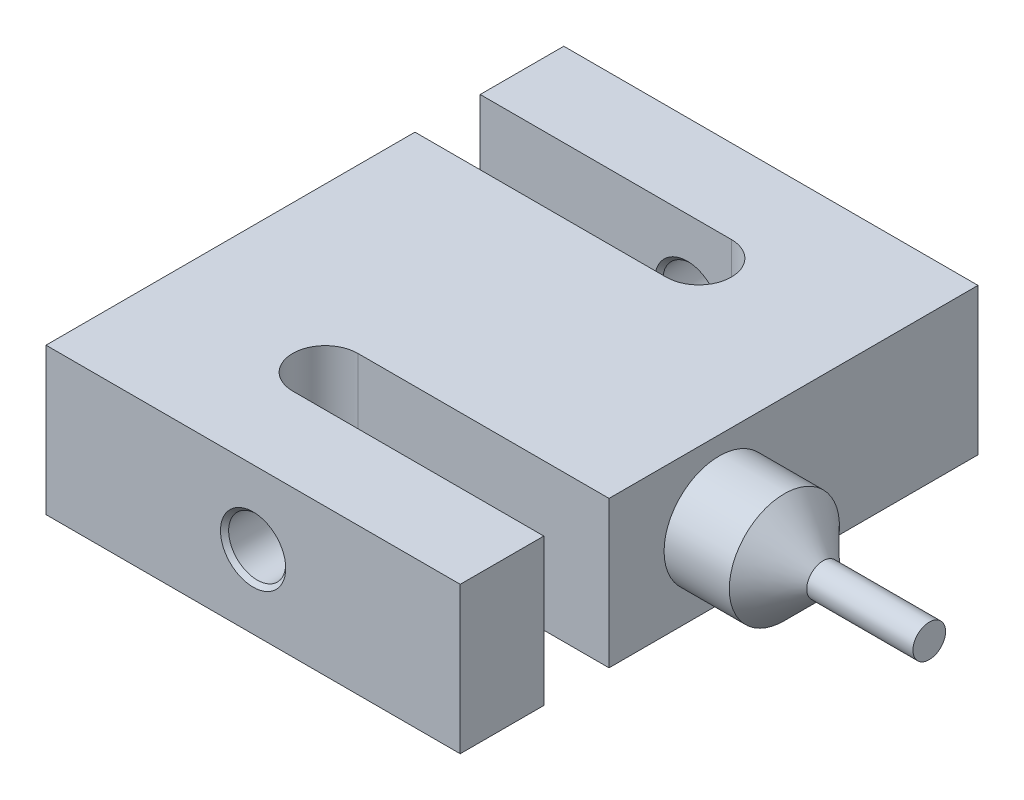
from build123d import *

# Parameters (mm, degrees)
BOSS_EXTRUDE1_DEPTH = 9
CIRPATTERN1_COUNT   = 2


# Read off the part's stored shape, not the designer's step: M8x1.0 Tapped Hole1
with BuildPart() as part:
    # Sketch1 → Boss-Extrude1 (new, symmetric)
    with BuildSketch(Plane(origin=(0, 0, 0), x_dir=(1, 0, 0), z_dir=(0, 1, 0))):
        with BuildLine():
            Line((-25.4, 0), (25.4, 0))
            Line((25.4, 0), (25.4, 31.75))
            Line((25.4, 31.75), (-25.4, 31.75))
            Line((-25.4, 31.75), (-25.4, 21.5))
            Line((-25.4, 21.5), (5.4, 21.5))
            ThreePointArc((5.4, 21.5), (9.4, 17.5), (5.4, 13.5))
            Line((5.4, 13.5), (-25.4, 13.5))
            Line((-25.4, 13.5), (-25.4, 0))
        make_face()
    boss_extrude1 = extrude(amount=BOSS_EXTRUDE1_DEPTH, both=True)

    # M8x1.0 Tapped Hole1 outline → M8x1.0 Tapped Hole1 (revolve, cut)
    with BuildSketch(Plane.XZ):
        Polygon((4, -21.5), (0, -21.5), (0, -31.75), (4, -31.75), (3.5, -31.25), (3.5, -22), align=None)
    m8x1_0_tapped_hole1 = revolve(axis=Axis((0, 0, 0), (0, 0, 1)), mode=Mode.SUBTRACT)

    # CirPattern1: Boss-Extrude1, M8x1.0 Tapped Hole1 ×2 about axis
    cirpattern1_axis = Axis((0, 0, 0), (0, 1, 0))
    add([boss_extrude1.rotate(cirpattern1_axis, i * 360 / CIRPATTERN1_COUNT) for i in range(1, CIRPATTERN1_COUNT)])
    add([m8x1_0_tapped_hole1.rotate(cirpattern1_axis, i * 360 / CIRPATTERN1_COUNT) for i in range(1, CIRPATTERN1_COUNT)], mode=Mode.SUBTRACT)

    # Sketch5 → Revolve1 (revolve)
    with BuildSketch(Plane(origin=(0, 0, 0), x_dir=(1, 0, 0), z_dir=(0, 1, 0)), mode=Mode.PRIVATE) as revolve1_sk:
        Polygon((25.4, 0), (51.171225178, 0), (51.171225178, 2), (38.15, 2), (33.4, 6.75), (25.4, 6.75), align=None)
    revolve(revolve1_sk.sketch.rotate(Axis((-80.9, 0, 0), (1, 0, 0)), 180), axis=Axis((-80.9, 0, 0), (1, 0, 0)))


solid = part.part
